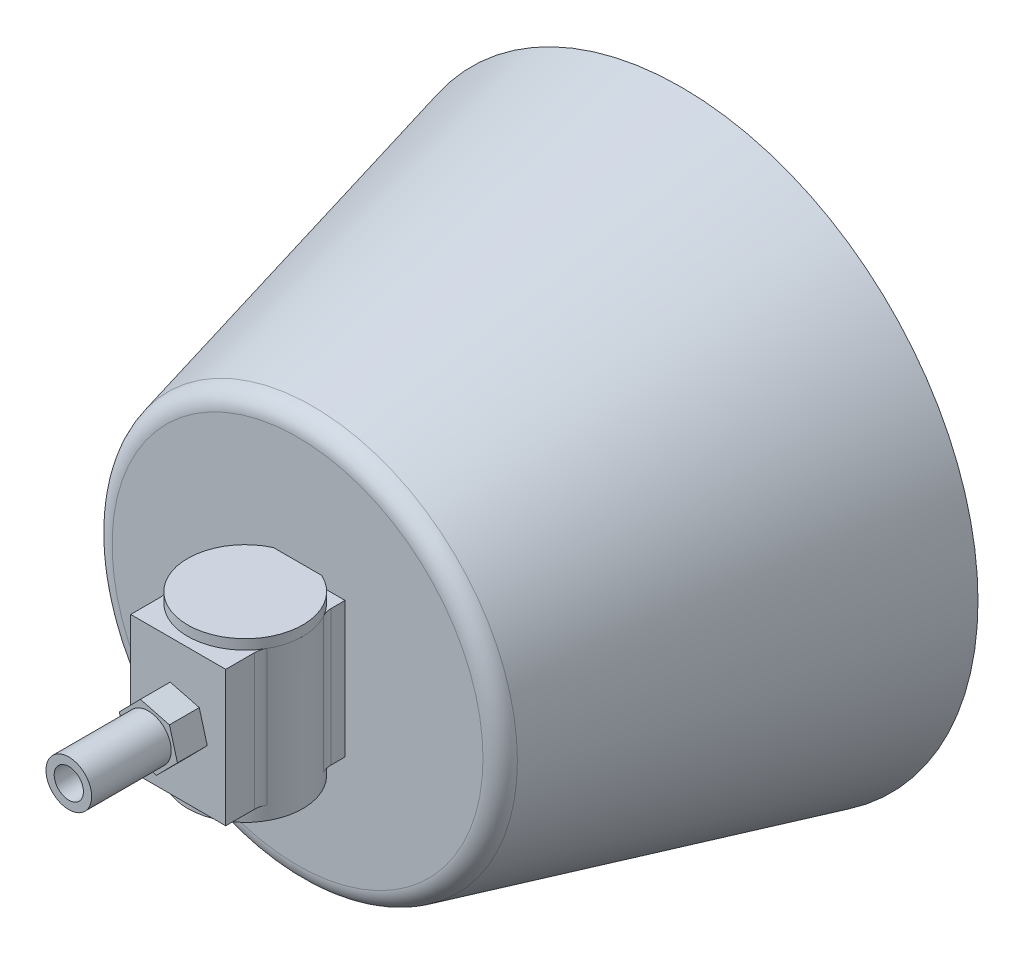
from build123d import *

# Parameters (mm, degrees)
SKETCH2_W           = 12.139554842
SKETCH2_H           = 17.312906794
BOSS_EXTRUDE1_DEPTH = 15.24
SKETCH3_R           = 7.354852585
BOSS_EXTRUDE2_DEPTH = 1.27
SKETCH4_R           = 7.343962116
BOSS_EXTRUDE3_DEPTH = 19.05
FILLET1_R           = 5.08
FILLET2_R           = 2.54
SKETCH5_R           = 2.9177626
BOSS_EXTRUDE4_DEPTH = 13.97
BOSS_EXTRUDE5_DEPTH = 3.81
FILLET3_R           = 2.54
SKETCH8_R           = 1.866604038
CUT_EXTRUDE1_DEPTH  = 54.61
FILLET4_R           = 2.54


with BuildPart() as part:
    # Sketch1 → Revolve1 (revolve)
    with BuildSketch(Plane(origin=(0, 0, 0), x_dir=(1, 0, 0), z_dir=(0, 1, 0))):
        Polygon((0, 0), (-25.668765954, 0), (-37.871949768, 49.023134977), (-35.374465572, 49.023134977), (-23.974578156, 3.227035533), (0, 3.227035533), align=None)
    revolve(axis=Axis((0, 0, -3.227035533), (0, 0, 1)))

    # Sketch2 → Boss-Extrude1 (add)
    with BuildSketch(Plane.XY):
        Rectangle(SKETCH2_W, SKETCH2_H)
    extrude(amount=BOSS_EXTRUDE1_DEPTH)

    # Sketch3 → Boss-Extrude2 (add)
    with BuildSketch(Plane(origin=(0, 8.656453397, 0), x_dir=(1, 0, 0), z_dir=(0, 1, 0))):
        with Locations((0, -6.679713392)):
            Circle(SKETCH3_R)
    extrude(amount=BOSS_EXTRUDE2_DEPTH)

    # Sketch4 → Boss-Extrude3 (add)
    with BuildSketch(Plane.XZ.offset(-8.656453397)):
        with Locations((0.010679396, 6.67757966)):
            Circle(SKETCH4_R)
    extrude(amount=BOSS_EXTRUDE3_DEPTH)

    # Fillet1
    fillet1_edges = [part.edges().sort_by_distance(p)[0] for p in [
        (23.974578156, 0, -3.227035533),
    ]]
    fillet(fillet1_edges, radius=FILLET1_R)

    # Fillet2
    fillet2_edges = [part.edges().sort_by_distance(p)[0] for p in [
        (25.668765954, 0, 0),
    ]]
    fillet(fillet2_edges, radius=FILLET2_R)

    # Sketch5 → Boss-Extrude4 (add)
    with BuildSketch(Plane.XY.offset(15.24)):
        Circle(SKETCH5_R)
    extrude(amount=BOSS_EXTRUDE4_DEPTH)

    # Sketch6 → Boss-Extrude5 (add)
    with BuildSketch(Plane.XY.offset(15.24)):
        Polygon((1.022367717, -3.695378883), (3.711475848, -0.962293026), (2.689108131, 2.733085857), (-1.022367717, 3.695378883), (-3.711475848, 0.962293026), (-2.689108131, -2.733085857), align=None)
    extrude(amount=BOSS_EXTRUDE5_DEPTH)

    # Fillet3
    # the kernel refuses this fillet: 2.54 mm, written as the material it adds along each edge
    with BuildSketch(Plane(origin=(6.069777421, -8.656453397, 2.527747051), x_dir=(0, 0, -1), z_dir=(0, 1, 0))) as fillet3_piece_1:
        with BuildLine():
            CenterArc((0.723381963, -2.54), FILLET3_R, 90, 29.540761072)
            ThreePointArc((-0.52894629, -0.330186898), (-0.260967221, -0.170709801), (0, 0))
            Line((0, 0), (0.723381963, 0))
        make_face()
    extrude(amount=17.312906794)
    with BuildSketch(Plane(origin=(6.069777421, -8.656453397, 10.827412269), x_dir=(0.5295323324681384, 0, -0.8482897552551564), z_dir=(0, 1, 0))) as fillet3_piece_2:
        with BuildLine():
            CenterArc((0.731374616, -2.537710116), FILLET3_R, 92.433100789, 29.540761072)
            Line((-0.613637508, -0.383054138), (0, 0))
            ThreePointArc((0, 0), (0.311772179, -0.006620794), (0.623544358, 0))
        make_face()
    extrude(amount=17.312906794)
    with BuildSketch(Plane(origin=(-6.069777421, -8.656453397, 10.796053219), x_dir=(-0.5254687488151466, 0, -0.8508129018877444), z_dir=(0, 1, 0))) as fillet3_piece_3:
        with BuildLine():
            CenterArc((0.724778579, 2.537751252), FILLET3_R, 238.300195445, 29.288660156)
            Line((-0.609912043, 0.376686481), (0, 0))
            ThreePointArc((0, 0), (0.308960404, 0.006501859), (0.617920808, 0))
        make_face()
    extrude(amount=17.312906794)
    with BuildSketch(Plane(origin=(-6.069777421, -8.656453397, 2.559106101), x_dir=(-0.5254687488151472, 0, 0.8508129018877438), z_dir=(0, 1, 0))) as fillet3_piece_4:
        with BuildLine():
            CenterArc((0.724778579, -2.537751252), FILLET3_R, 92.411144399, 29.288660156)
            Line((-0.609912043, -0.376686481), (0, 0))
            ThreePointArc((0, 0), (0.308960404, -0.006501859), (0.617920808, 0))
        make_face()
    extrude(amount=17.312906794)

    # Sketch8 → Cut-Extrude1 (cut)
    with BuildSketch(Plane(origin=(0, 0, -3.227035533), x_dir=(-1, 0, 0), z_dir=(0, 0, -1))):
        Circle(SKETCH8_R)
    extrude(amount=-CUT_EXTRUDE1_DEPTH, mode=Mode.SUBTRACT)

    # Fillet4
    fillet4_edges = [part.edges().sort_by_distance(p)[0] for p in [
        (1.866604038, 0, -3.227035533),
    ]]
    fillet(fillet4_edges, radius=FILLET4_R)


solid = part.part
